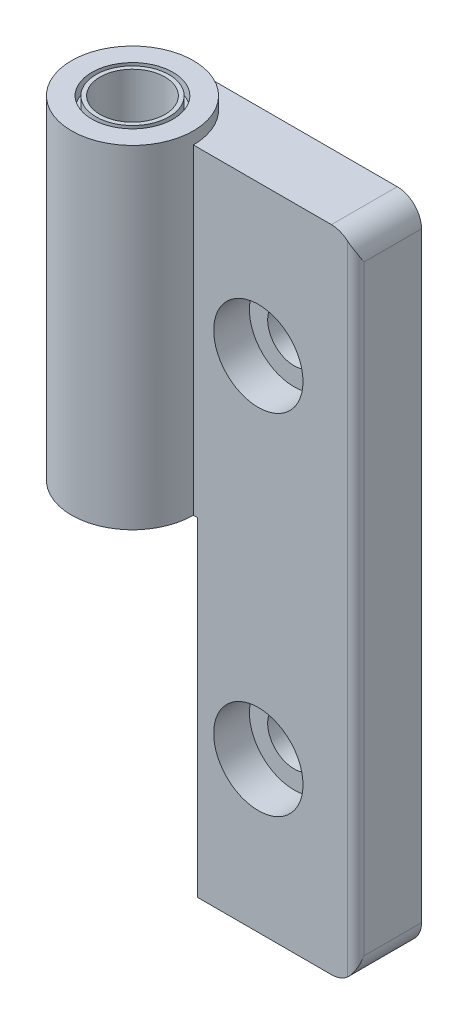
from build123d import *

# Parameters (mm, degrees)
EXTRUDE1_DEPTH       = 39.5
SKETCH2_W            = 19.5
SKETCH2_H            = 8.1
EXTRUDE2_DEPTH       = 40.5
EXTRUDE3_START       = 1.5
SKETCH3_R            = 7.5
EXTRUDE3_DEPTH       = 1.5
HOLEWZD1_D           = 10
HOLEWZD1_DEPTH       = 1.5
SKETCH6_W            = 4.5
SKETCH6_H            = 1.5
HOLEWZD2_D           = 8
HOLEWZD2_DEPTH       = 81.500025
HOLEWZD3_D           = 6.5
HOLEWZD3_CBORE_D     = 11
HOLEWZD3_CBORE_DEPTH = 4.4
FILLET1_R            = 1
FILLET2_R            = 3


with BuildPart() as part:
    # Sketch1 → Extrude1 (new body)
    with BuildSketch(Plane(origin=(0, 40, 0), x_dir=(1, 0, 0), z_dir=(0, 1, 0))):
        with BuildLine():
            Line((27.5, 8.1), (2, 8.1))
            Line((2, 8.1), (2, 7.228416147))
            ThreePointArc((2, 7.228416147), (-5.968668193, -4.541475531), (7.5, 0))
            Line((7.5, 0), (27.5, 0))
            Line((27.5, 0), (27.5, 8.1))
        make_face()
    extrude(amount=-EXTRUDE1_DEPTH)

    # Sketch2 → Extrude2 (add)
    with BuildSketch(Plane.XZ.offset(-0.5)):
        with Locations((17.75, -4.05)):
            Rectangle(SKETCH2_W, SKETCH2_H)
    extrude(amount=EXTRUDE2_DEPTH)

    # Sketch3 → Extrude3 (add)
    with BuildSketch(Plane(origin=(0, 40, 0), x_dir=(-1, 0, 0), z_dir=(0, 1, 0)).offset(EXTRUDE3_START)):
        with Locations(Location((0, 0, 0), (0, 0, 90))):
            Circle(SKETCH3_R)
    extrude(amount=-EXTRUDE3_DEPTH)

    # HoleWzd1
    with Locations(Plane(origin=(0, 41.5, 0), x_dir=(1, 0, 0), z_dir=(0, 1, 0))):
        with Locations((0, 0)):
            Hole(HOLEWZD1_D / 2, depth=HOLEWZD1_DEPTH)

    # Sketch6 → Revolve1 (revolve)
    with BuildSketch(Plane(origin=(0, 0, 0), x_dir=(-1, 0, 0), z_dir=(0, 0, -1)), mode=Mode.PRIVATE) as revolve1_sk:
        with Locations((-2.25, 40.75)):
            Rectangle(SKETCH6_W, SKETCH6_H)
    revolve(revolve1_sk.sketch.rotate(Axis((0, 40, 0), (0, 1, 0)), 270), axis=Axis((0, 40, 0), (0, 1, 0)))

    # HoleWzd2
    with Locations(Plane(origin=(0, 41.5, 0), x_dir=(1, 0, 0), z_dir=(0, 1, 0))):
        with Locations((0, 0)):
            Hole(HOLEWZD2_D / 2, depth=HOLEWZD2_DEPTH)

    # HoleWzd3 (through all)
    with Locations(Plane.XY):
        with Locations((15.5, 21.5), (15.5, -21.5)):
            CounterBoreHole(HOLEWZD3_D / 2, HOLEWZD3_CBORE_D / 2, HOLEWZD3_CBORE_DEPTH)

    # Fillet1
    fillet1_edges = [part.edges().sort_by_distance(p)[0] for p in [
        (27.5, 0, 0),
    ]]
    fillet(fillet1_edges, radius=FILLET1_R)

    # Fillet2
    # the kernel refuses this fillet: 3 mm, written as the material it takes off along each edge
    with BuildSketch(Plane(origin=(27.5, 40, 6.5), x_dir=(-1, 0, 0), z_dir=(0, 0, -1))) as fillet2_piece_1:
        with BuildLine():
            CenterArc((FILLET2_R, -FILLET2_R), FILLET2_R, 90, 90)
            Line((0, -FILLET2_R), (0, 0))
            Line((0, 0), (FILLET2_R, 0))
        make_face()
    extrude(amount=22.1, mode=Mode.SUBTRACT)
    with BuildSketch(Plane(origin=(27.5, -40, 6.5), x_dir=(-1, 0, 0), z_dir=(0, 0, -1))) as fillet2_piece_2:
        with BuildLine():
            CenterArc((FILLET2_R, FILLET2_R), FILLET2_R, 180, 90)
            Line((0, FILLET2_R), (0, 0))
            Line((0, 0), (FILLET2_R, 0))
        make_face()
    extrude(amount=22.1, mode=Mode.SUBTRACT)


solid = part.part
